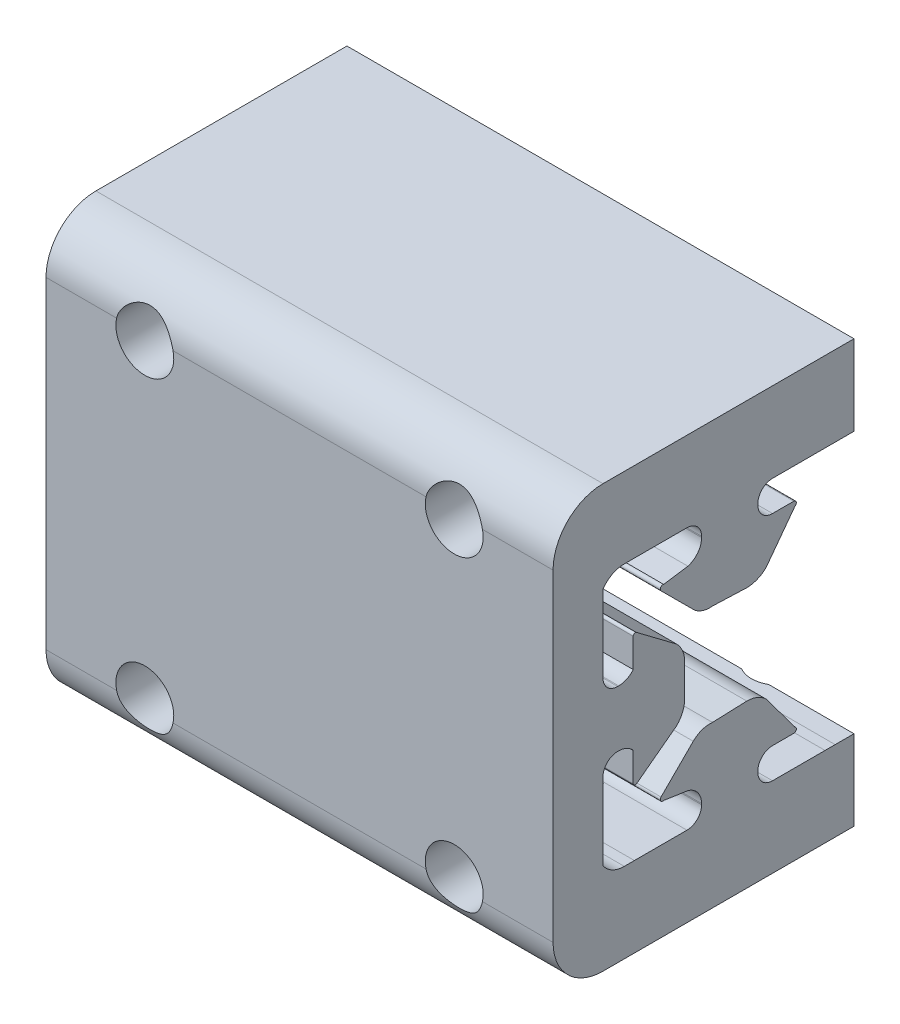
from build123d import *

# Parameters (mm, degrees)
SKETCH1_W           = 50.8
SKETCH1_H           = 42.3
SKETCH1_R           = 2.9
BOSS_EXTRUDE1_DEPTH = 5
BOSS_EXTRUDE2_START = -25.4
BOSS_EXTRUDE2_DEPTH = 50.8
SKETCH5_R           = 2
CUT_EXTRUDE1_DEPTH  = 49.431837541
CUT_EXTRUDE3_START  = -50.8
CUT_EXTRUDE3_DEPTH  = 50.8
FILLET1_R           = 5
CHAMFER1_SIZE       = 0.75
CUT_EXTRUDE4_START  = -13.3
SKETCH7_R           = 2.9
CUT_EXTRUDE4_DEPTH  = 13.3


# Read off the part's stored shape, not the designer's step: Boss-Extrude2, Cut-Extrude3
with BuildPart() as part:
    # Sketch1 → Boss-Extrude1 (new body)
    with BuildSketch(Plane.XY):
        Rectangle(SKETCH1_W, SKETCH1_H)
        with Locations((-15.5, 15.5)):
            Circle(SKETCH1_R, mode=Mode.SUBTRACT)
        with Locations((15.5, 15.5)):
            Circle(SKETCH1_R, mode=Mode.SUBTRACT)
        with Locations((15.5, -15.5)):
            Circle(SKETCH1_R, mode=Mode.SUBTRACT)
        with Locations((-15.5, -15.5)):
            Circle(SKETCH1_R, mode=Mode.SUBTRACT)
    extrude(amount=BOSS_EXTRUDE1_DEPTH)

    # Boss-Extrude2 outline → Boss-Extrude2 (add)
    with BuildSketch(Plane(origin=(0, 0, 0), x_dir=(0, 0, -1), z_dir=(1, 0, 0)).offset(BOSS_EXTRUDE2_START)):
        with BuildLine():
            Line((0, -21.15), (30.400005474, -21.15))
            Line((30.400005474, -21.15), (30.400005474, 21.15))
            Line((30.400005474, 21.15), (0, 21.15))
            Line((0, 21.15), (0, 11.987252615))
            ThreePointArc((0, 11.987252615), (0.923811374, 12.825411162), (2.135935226, 13.119847863))
            Line((2.135935226, 13.119847863), (3.149525361, 13.12))
            Line((3.149525361, 13.12), (8.412487593, 13.12))
            ThreePointArc((8.412487593, 13.12), (9.451236228, 12.689736228), (9.8815, 11.650987593))
            Line((9.8815, 11.650987593), (9.8815, 11.539212407))
            ThreePointArc((9.8815, 11.539212407), (9.499185803, 10.406544843), (8.508651104, 9.737260924))
            Line((8.508651104, 9.737260924), (6.078424782, 9.375323776))
            ThreePointArc((6.078424782, 9.375323776), (5.77811164, 9.261306372), (5.817063523, 8.942447936))
            Line((5.817063523, 8.942447936), (9.044443768, 5.720945929))
            ThreePointArc((9.044443768, 5.720945929), (9.932881565, 5.163971691), (10.975024591, 5.047868576))
            Line((10.975024591, 5.047868576), (14.409637243, 4.915800027))
            ThreePointArc((14.409637243, 4.915800027), (15.461894751, 5.124828375), (16.354531507, 5.719923608))
            Line((16.354531507, 5.719923608), (19.237268165, 9.579204684))
            ThreePointArc((19.237268165, 9.579204684), (19.369234109, 9.872061108), (19.116408329, 10.0702))
            Line((19.116408329, 10.0702), (16.987512407, 10.0702))
            ThreePointArc((16.987512407, 10.0702), (15.948763772, 10.500463772), (15.5185, 11.539212407))
            Line((15.5185, 11.539212407), (15.5185, 11.650987593))
            ThreePointArc((15.5185, 11.650987593), (15.948763772, 12.689736228), (16.987512407, 13.12))
            Line((16.987512407, 13.12), (22.250474639, 13.12))
            Line((22.250474639, 13.12), (23.264064774, 13.119847863))
            ThreePointArc((23.264064774, 13.119847863), (25.07952406, 12.379490669), (25.819847344, 10.564017555))
            Line((25.819847344, 10.564017555), (25.819999481, 9.550431413))
            Line((25.819999481, 9.550431413), (25.819997837, 6.333083168))
            Line((25.819997837, 6.333083168), (25.819973902, 5.258893225))
            Line((25.819973902, 5.258893225), (25.819973902, 3.577840058))
            ThreePointArc((25.819973902, 3.577840058), (25.16220606, 3.033476565), (24.330968068, 2.838454649))
            Line((24.330968068, 2.838454649), (24.219192883, 2.838454411))
            ThreePointArc((24.219192883, 2.838454411), (22.911741126, 3.380016215), (22.370176539, 4.687466818))
            Line((22.370176539, 4.687466818), (22.370176539, 6.402082132))
            ThreePointArc((22.370176539, 6.402082132), (21.879418608, 7.12471472), (21.026748485, 6.934991594))
            Line((21.026748485, 6.934991594), (18.413864758, 3.539540659))
            ThreePointArc((18.413864758, 3.539540659), (17.799058283, 2.663234422), (17.628483098, 1.606445073))
            Line((17.628483098, 1.606445073), (17.628483126, 1.593202051))
            Line((17.628483126, 1.593202051), (17.628483098, -1.606445073))
            ThreePointArc((17.628483098, -1.606445073), (17.799058283, -2.663234422), (18.413864758, -3.539540659))
            Line((18.413864758, -3.539540659), (21.026748485, -6.934991594))
            ThreePointArc((21.026748485, -6.934991594), (21.879418608, -7.12471472), (22.370176539, -6.402082132))
            Line((22.370176539, -6.402082132), (22.370176539, -4.687466818))
            ThreePointArc((22.370176539, -4.687466818), (22.911741126, -3.380016215), (24.219192883, -2.838454411))
            Line((24.219192883, -2.838454411), (24.330968068, -2.838454649))
            ThreePointArc((24.330968068, -2.838454649), (25.16220606, -3.033476565), (25.819973902, -3.577840058))
            Line((25.819973902, -3.577840058), (25.819973902, -5.258888546))
            Line((25.819973902, -5.258888546), (25.819997837, -6.333087739))
            Line((25.819997837, -6.333087739), (25.819999481, -9.550431413))
            Line((25.819999481, -9.550431413), (25.819847344, -10.564017555))
            ThreePointArc((25.819847344, -10.564017555), (25.07952406, -12.379490669), (23.264064774, -13.119847863))
            Line((23.264064774, -13.119847863), (22.250474639, -13.12))
            Line((22.250474639, -13.12), (16.987512407, -13.12))
            ThreePointArc((16.987512407, -13.12), (15.948763772, -12.689736228), (15.5185, -11.650987593))
            Line((15.5185, -11.650987593), (15.5185, -11.539212407))
            ThreePointArc((15.5185, -11.539212407), (15.948763772, -10.500463772), (16.987512407, -10.0702))
            Line((16.987512407, -10.0702), (19.116408329, -10.0702))
            ThreePointArc((19.116408329, -10.0702), (19.369234109, -9.872061108), (19.237268165, -9.579204684))
            Line((19.237268165, -9.579204684), (16.354531507, -5.719923608))
            ThreePointArc((16.354531507, -5.719923608), (15.461894751, -5.124828375), (14.409637243, -4.915800027))
            Line((14.409637243, -4.915800027), (10.975024591, -5.047868576))
            ThreePointArc((10.975024591, -5.047868576), (9.932881565, -5.163971691), (9.044443768, -5.720945929))
            Line((9.044443768, -5.720945929), (5.817063523, -8.942447936))
            ThreePointArc((5.817063523, -8.942447936), (5.77811164, -9.261306372), (6.078424782, -9.375323776))
            Line((6.078424782, -9.375323776), (8.508651104, -9.737260924))
            ThreePointArc((8.508651104, -9.737260924), (9.499185803, -10.406544843), (9.8815, -11.539212407))
            Line((9.8815, -11.539212407), (9.8815, -11.650987593))
            ThreePointArc((9.8815, -11.650987593), (9.451236228, -12.689736228), (8.412487593, -13.12))
            Line((8.412487593, -13.12), (3.149525361, -13.12))
            Line((3.149525361, -13.12), (2.135935226, -13.119847863))
            ThreePointArc((2.135935226, -13.119847863), (0.923811374, -12.825411162), (0, -11.987252615))
            Line((0, -11.987252615), (0, -21.15))
        make_face()
        with BuildLine():
            Line((0, 4.287469289), (0, -4.287469289))
            ThreePointArc((0, -4.287469289), (0.430263772, -3.248720654), (1.469012407, -2.818456882))
            Line((1.469012407, -2.818456882), (1.580787593, -2.818456882))
            ThreePointArc((1.580787593, -2.818456882), (2.382924119, -2.999338852), (3.0298, -3.506973452))
            Line((3.0298, -3.506973452), (3.0298, -6.402089023))
            ThreePointArc((3.0298, -6.402089023), (3.153007381, -6.591638668), (3.376252906, -6.555993718))
            Line((3.376252906, -6.555993718), (7.383336021, -3.542505908))
            ThreePointArc((7.383336021, -3.542505908), (7.981451693, -2.648289036), (8.1915, -1.593184358))
            Line((8.1915, -1.593184358), (8.1915, 1.593184358))
            ThreePointArc((8.1915, 1.593184358), (7.981451693, 2.648289036), (7.383336021, 3.542505908))
            Line((7.383336021, 3.542505908), (3.376252906, 6.555993718))
            ThreePointArc((3.376252906, 6.555993718), (3.153007381, 6.591638668), (3.0298, 6.402089023))
            Line((3.0298, 6.402089023), (3.0298, 3.506973452))
            ThreePointArc((3.0298, 3.506973452), (2.382924119, 2.999338852), (1.580787593, 2.818456882))
            Line((1.580787593, 2.818456882), (1.469012407, 2.818456882))
            ThreePointArc((1.469012407, 2.818456882), (0.430263772, 3.248720654), (0, 4.287469289))
        make_face()
    extrude(amount=BOSS_EXTRUDE2_DEPTH)

    # Sketch5 → Cut-Extrude1 (cut, through all)
    with BuildSketch(Plane.XY.offset(5)):
        with Locations((-15.5, -15.5)):
            Circle(SKETCH5_R)
        with Locations((15.5, -15.5)):
            Circle(SKETCH5_R)
        with Locations((15.5, 15.5)):
            Circle(SKETCH5_R)
        with Locations((-15.5, 15.5)):
            Circle(SKETCH5_R)
    extrude(amount=-CUT_EXTRUDE1_DEPTH, mode=Mode.SUBTRACT)

    # Cut-Extrude3 outline → Cut-Extrude3 (cut)
    with BuildSketch(Plane(origin=(25.4, 0, 0), x_dir=(0, 0, -1), z_dir=(1, 0, 0)).offset(CUT_EXTRUDE3_START)):
        with BuildLine():
            Line((23.291800001, -13.12), (25.15, -13.12))
            Line((25.15, -13.12), (25.15, -21.15))
            Line((25.15, -21.15), (30.400005474, -21.15))
            Line((30.400005474, -21.15), (30.400005474, 21.15))
            Line((30.400005474, 21.15), (25.15, 21.15))
            Line((25.15, 21.15), (25.15, 13.12))
            Line((25.15, 13.12), (23.291800001, 13.12))
            ThreePointArc((23.291800001, 13.12), (25.089303105, 12.369657652), (25.819847344, 10.564017555))
            Line((25.819847344, 10.564017555), (25.819999481, 9.550431413))
            Line((25.819999481, 9.550431413), (25.819997837, 6.333083168))
            Line((25.819997837, 6.333083168), (25.819973902, 5.258893225))
            Line((25.819973902, 5.258893225), (25.819973902, 3.577840058))
            ThreePointArc((25.819973902, 3.577840058), (25.16220606, 3.033476565), (24.330968068, 2.838454649))
            Line((24.330968068, 2.838454649), (24.219192883, 2.838454411))
            ThreePointArc((24.219192883, 2.838454411), (22.911741126, 3.380016215), (22.370176539, 4.687466818))
            Line((22.370176539, 4.687466818), (22.370176539, 6.402082132))
            ThreePointArc((22.370176539, 6.402082132), (21.879418608, 7.12471472), (21.026748485, 6.934991594))
            Line((21.026748485, 6.934991594), (18.413864758, 3.539540659))
            ThreePointArc((18.413864758, 3.539540659), (17.799058283, 2.663234422), (17.628483098, 1.606445073))
            Line((17.628483098, 1.606445073), (17.628483126, 1.593202051))
            Line((17.628483126, 1.593202051), (17.628483098, -1.606445073))
            ThreePointArc((17.628483098, -1.606445073), (17.799058283, -2.663234422), (18.413864758, -3.539540659))
            Line((18.413864758, -3.539540659), (21.026748485, -6.934991594))
            ThreePointArc((21.026748485, -6.934991594), (21.879418608, -7.12471472), (22.370176539, -6.402082132))
            Line((22.370176539, -6.402082132), (22.370176539, -4.687466818))
            ThreePointArc((22.370176539, -4.687466818), (22.911741126, -3.380016215), (24.219192883, -2.838454411))
            Line((24.219192883, -2.838454411), (24.330968068, -2.838454649))
            ThreePointArc((24.330968068, -2.838454649), (25.16220606, -3.033476565), (25.819973902, -3.577840058))
            Line((25.819973902, -3.577840058), (25.819973902, -5.258888546))
            Line((25.819973902, -5.258888546), (25.819997837, -6.333087739))
            Line((25.819997837, -6.333087739), (25.819999481, -9.550431413))
            Line((25.819999481, -9.550431413), (25.819847344, -10.564017555))
            ThreePointArc((25.819847344, -10.564017555), (25.089303105, -12.369657652), (23.291800001, -13.12))
        make_face()
    extrude(amount=CUT_EXTRUDE3_DEPTH, mode=Mode.SUBTRACT)

    # Fillet1
    # the kernel refuses this fillet: 5 mm, written as the material it takes off along each edge
    with BuildSketch(Plane(origin=(-37.9, 21.15, 5), x_dir=(0, -1, 0), z_dir=(1, 0, 0))) as fillet1_piece_1:
        with BuildLine():
            CenterArc((FILLET1_R, FILLET1_R), FILLET1_R, 180, 90)
            Line((0, FILLET1_R), (0, 0))
            Line((0, 0), (FILLET1_R, 0))
        make_face()
    extrude(amount=75.8, mode=Mode.SUBTRACT)
    with BuildSketch(Plane(origin=(37.9, -21.15, 5), x_dir=(0, 0, -1), z_dir=(-1, 0, 0))) as fillet1_piece_2:
        with BuildLine():
            CenterArc((FILLET1_R, -FILLET1_R), FILLET1_R, 90, 90)
            Line((0, -FILLET1_R), (0, 0))
            Line((0, 0), (FILLET1_R, 0))
        make_face()
    extrude(amount=75.8, mode=Mode.SUBTRACT)

    # Chamfer1
    # the kernel refuses this chamfer: 0.75 mm, written as the material it takes off along each edge
    with BuildSketch(Plane(origin=(-15.5, 15.5, -25.15), x_dir=(1, 0, 0), z_dir=(0, -1, 0))) as chamfer1_piece_1:
        Polygon((2 + CHAMFER1_SIZE, 0), (2, CHAMFER1_SIZE), (2, 0), align=None)
    revolve(axis=Axis((-15.5, 15.5, -25.15), (0, 0, 1)), mode=Mode.SUBTRACT)
    with BuildSketch(Plane(origin=(15.5, 15.5, -25.15), x_dir=(1, 0, 0), z_dir=(0, -1, 0))) as chamfer1_piece_2:
        Polygon((2 + CHAMFER1_SIZE, 0), (2, CHAMFER1_SIZE), (2, 0), align=None)
    revolve(axis=Axis((15.5, 15.5, -25.15), (0, 0, 1)), mode=Mode.SUBTRACT)
    with BuildSketch(Plane(origin=(15.5, -15.5, -25.15), x_dir=(1, 0, 0), z_dir=(0, -1, 0))) as chamfer1_piece_3:
        Polygon((2 + CHAMFER1_SIZE, 0), (2, CHAMFER1_SIZE), (2, 0), align=None)
    revolve(axis=Axis((15.5, -15.5, -25.15), (0, 0, 1)), mode=Mode.SUBTRACT)
    with BuildSketch(Plane(origin=(-15.5, -15.5, -25.15), x_dir=(1, 0, 0), z_dir=(0, -1, 0))) as chamfer1_piece_4:
        Polygon((2 + CHAMFER1_SIZE, 0), (2, CHAMFER1_SIZE), (2, 0), align=None)
    revolve(axis=Axis((-15.5, -15.5, -25.15), (0, 0, 1)), mode=Mode.SUBTRACT)

    # Sketch7 → Cut-Extrude4 (cut)
    with BuildSketch(Plane.XY.offset(5).offset(CUT_EXTRUDE4_START)):
        with Locations(Location((-15.5, 15.5, 0), (0, 0, 167.047809404))):
            Circle(SKETCH7_R)
        with Locations(Location((-15.5, -15.5, 0), (0, 0, 192.952190596))):
            Circle(SKETCH7_R)
        with Locations(Location((15.5, -15.5, 0), (0, 0, 192.952190596))):
            Circle(SKETCH7_R)
        with Locations(Location((15.5, 15.5, 0), (0, 0, 167.047809404))):
            Circle(SKETCH7_R)
    extrude(amount=CUT_EXTRUDE4_DEPTH, mode=Mode.SUBTRACT)


solid = part.part
